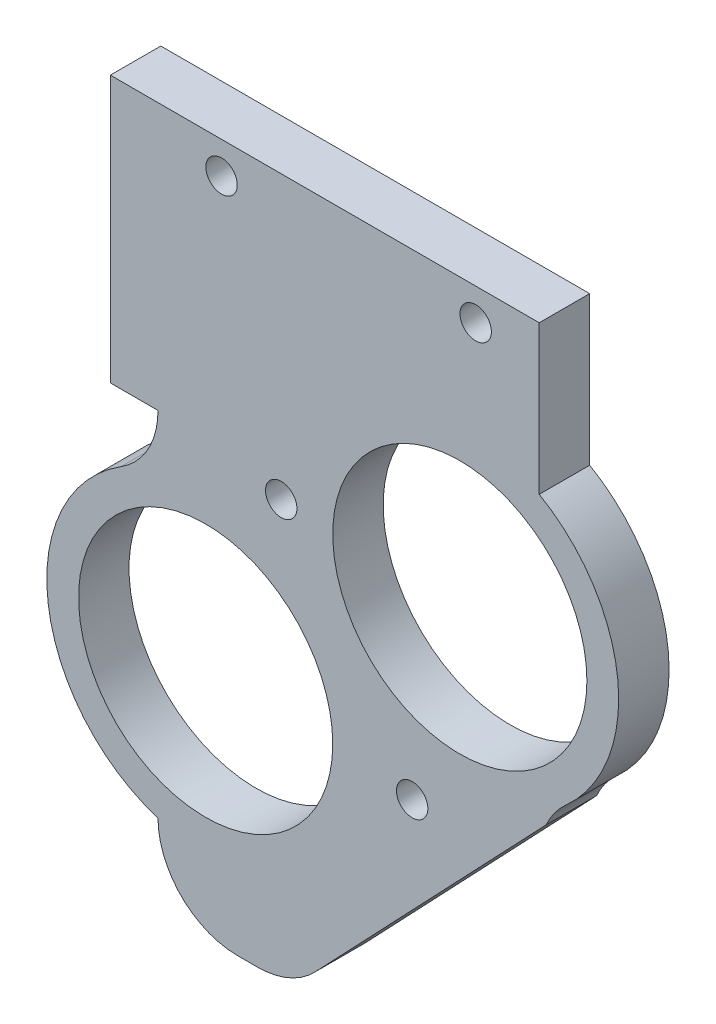
from build123d import *

# Parameters (mm, degrees)
SKETCH1_R           = 16
BOSS_EXTRUDE1_DEPTH = 6.35
FILLET1_R           = 10
SKETCH2_W           = 48
SKETCH2_H           = 20
BOSS_EXTRUDE2_DEPTH = 6.35
SKETCH4_W           = 6.35
SKETCH4_H           = 33.563954303
BOSS_EXTRUDE3_DEPTH = 6
SKETCH5_R           = 1.976318005
CUT_EXTRUDE1_DEPTH  = 85.265533897
SKETCH6_R           = 0.818763353
CUT_EXTRUDE2_DEPTH  = 4
CUT_EXTRUDE3_DEPTH  = 85.265533897
FILLET2_R           = 10


with BuildPart() as part:
    # Sketch1 → Boss-Extrude1 (new body)
    with BuildSketch(Plane.XY):
        with BuildLine():
            Line((15.771494463, -0.425728707), (39.940720481, -0.425728707))
            Line((39.940720481, -0.425728707), (39.940720481, 14.222654346))
            ThreePointArc((39.940720481, 14.222654346), (46.645253692, 42.541279088), (17.982311374, 47.574271293))
            Line((17.982311374, 47.574271293), (-8.059279519, 47.574271293))
            Line((-8.059279519, 47.574271293), (-8.059279519, 27.711945938))
            ThreePointArc((-8.059279519, 27.711945938), (-17.321126946, -4.292626776), (15.771494463, -0.425728707))
        make_face()
        with Locations((-2.059279519, 8.63316191)):
            Circle(SKETCH1_R, mode=Mode.SUBTRACT)
        with Locations((29.940720481, 31.543162422)):
            Circle(SKETCH1_R, mode=Mode.SUBTRACT)
    extrude(amount=BOSS_EXTRUDE1_DEPTH)

    # Fillet1
    fillet1_edges = [part.edges().sort_by_distance(p)[0] for p in [
        (17.982311374, 47.574271293, 3.175),
        (39.940720481, 14.222654346, 3.175),
        (15.771494463, -0.425728707, 3.175),
        (-8.059279519, 27.711945938, 3.175),
    ]]
    fillet(fillet1_edges, radius=FILLET1_R)

    # Sketch2 → Boss-Extrude2 (add)
    with BuildSketch(Plane(origin=(0, 0, 0), x_dir=(-1, 0, 0), z_dir=(0, 0, -1))):
        with Locations((-15.940720481, 57.574271293)):
            Rectangle(SKETCH2_W, SKETCH2_H)
        with BuildLine():
            Line((-39.940720481, -0.425728707), (-39.940720481, -20.425728707))
            Line((-39.940720481, -20.425728707), (8.059279519, -20.425728707))
            Line((8.059279519, -20.425728707), (8.059279519, -6.199235065))
            ThreePointArc((8.059279519, -6.199235065), (-2.550706673, -6.68832716), (-11.129219288, -0.425728707))
            Line((-11.129219288, -0.425728707), (-39.940720481, -0.425728707))
        make_face()
    extrude(amount=-BOSS_EXTRUDE2_DEPTH)

    # Sketch4 → Boss-Extrude3 (add)
    with BuildSketch(Plane.ZY.offset(8.059279519)):
        with Locations((3.175, 50.792294142)):
            Rectangle(SKETCH4_W, SKETCH4_H)
    extrude(amount=BOSS_EXTRUDE3_DEPTH)

    # Sketch5 → Cut-Extrude1 (cut, through all)
    with BuildSketch(Plane.XY.offset(6.35)):
        with Locations((31.940720481, 63.574271293)):
            Circle(SKETCH5_R)
        with Locations((-0.059279519, 63.574271293)):
            Circle(SKETCH5_R)
        with Locations((23.940720481, 7.574271293)):
            Circle(SKETCH5_R)
        with Locations((7.455439106, 32.059552667)):
            Circle(SKETCH5_R)
    extrude(amount=-CUT_EXTRUDE1_DEPTH, mode=Mode.SUBTRACT)

    # Sketch6 → Cut-Extrude2 (cut)
    with BuildSketch(Plane.ZY.offset(14.059279519)):
        with Locations(Location((2.747841942, 62.56121214, 0), (0, 0, 270))):
            Circle(SKETCH6_R)
        with Locations(Location((2.756756589, 51.313832117, 0), (0, 0, 270))):
            Circle(SKETCH6_R)
        with Locations(Location((2.756756589, 40.313832117, 0), (0, 0, 270))):
            Circle(SKETCH6_R)
    extrude(amount=-CUT_EXTRUDE2_DEPTH, mode=Mode.SUBTRACT)

    # Sketch7 → Cut-Extrude3 (cut, through all)
    with BuildSketch(Plane(origin=(0, 0, 0), x_dir=(-1, 0, 0), z_dir=(0, 0, -1))):
        Polygon((-40.812011189, 13.264965551), (-6.140614995, -23.185471789), (-44.163616568, -23.185471789), (-44.163616568, 13.264965551), align=None)
    extrude(amount=-CUT_EXTRUDE3_DEPTH, mode=Mode.SUBTRACT)

    # Fillet2
    # the kernel refuses this fillet: 10 mm, written as the material it takes off along each edge
    with BuildSketch(Plane(origin=(-8.059279519, -20.425728707, -25), x_dir=(1, 0, 0), z_dir=(0, 0, 1))) as fillet2_piece_1_section:
        with BuildLine():
            CenterArc((FILLET2_R, FILLET2_R), FILLET2_R, 180, 90)
            Line((0, FILLET2_R), (0, 0))
            Line((0, 0), (FILLET2_R, 0))
        make_face()
    fillet2_piece_1 = extrude(amount=56.35, mode=Mode.PRIVATE)
    fillet2_piece_1 = fillet2_piece_1 - Plane(origin=(-2.059279519, 8.63316191, 3.175), x_dir=(-0.30000000000000054, 0.9539392014169455, 0), z_dir=(0, 0, -1)) * Cylinder(20, 153, mode=Mode.PRIVATE)
    add(fillet2_piece_1, mode=Mode.SUBTRACT)
    with BuildSketch(Plane(origin=(8.765662944, -20.425728707, -10.72351028), x_dir=(0.6892036325040336, 0.7245677007314395, 0), z_dir=(0, 0, 1))) as fillet2_piece_2:
        with BuildLine():
            CenterArc((FILLET2_R * 0.428940411203, FILLET2_R), FILLET2_R, 223.567102496, 46.432897504)
            Line((-FILLET2_R * 0.295627289529, FILLET2_R * 0.310796367496), (0, 0))
            Line((0, 0), (FILLET2_R * 0.428940411203, 0))
        make_face()
    extrude(amount=27.79702056, mode=Mode.SUBTRACT)


solid = part.part
